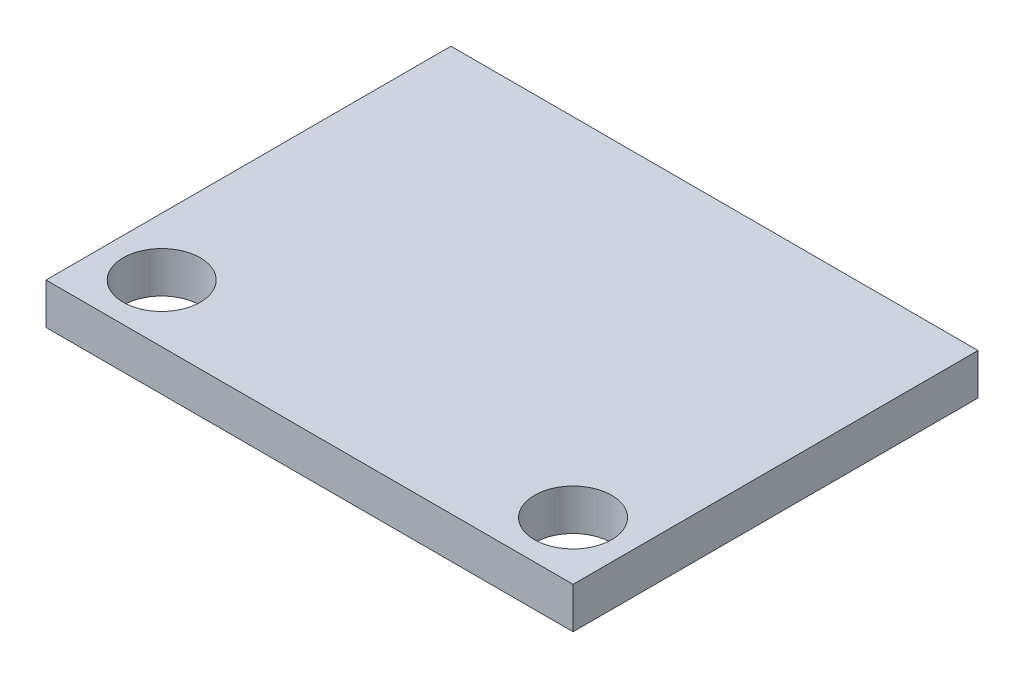
from build123d import *

# Parameters (mm, degrees)
SKETCH1_W           = 20.5
SKETCH1_H           = 15.75
SKETCH1_R           = 1.5
BOSS_EXTRUDE1_DEPTH = 1.6


with BuildPart() as part:
    # Sketch1 → Boss-Extrude1 (new body)
    with BuildSketch(Plane(origin=(0, 0, 0), x_dir=(1, 0, 0), z_dir=(0, 1, 0))):
        Rectangle(SKETCH1_W, SKETCH1_H)
        with Locations((8, -5.625)):
            Circle(SKETCH1_R, mode=Mode.SUBTRACT)
        with Locations((-8, -5.625)):
            Circle(SKETCH1_R, mode=Mode.SUBTRACT)
    extrude(amount=BOSS_EXTRUDE1_DEPTH)


solid = part.part
